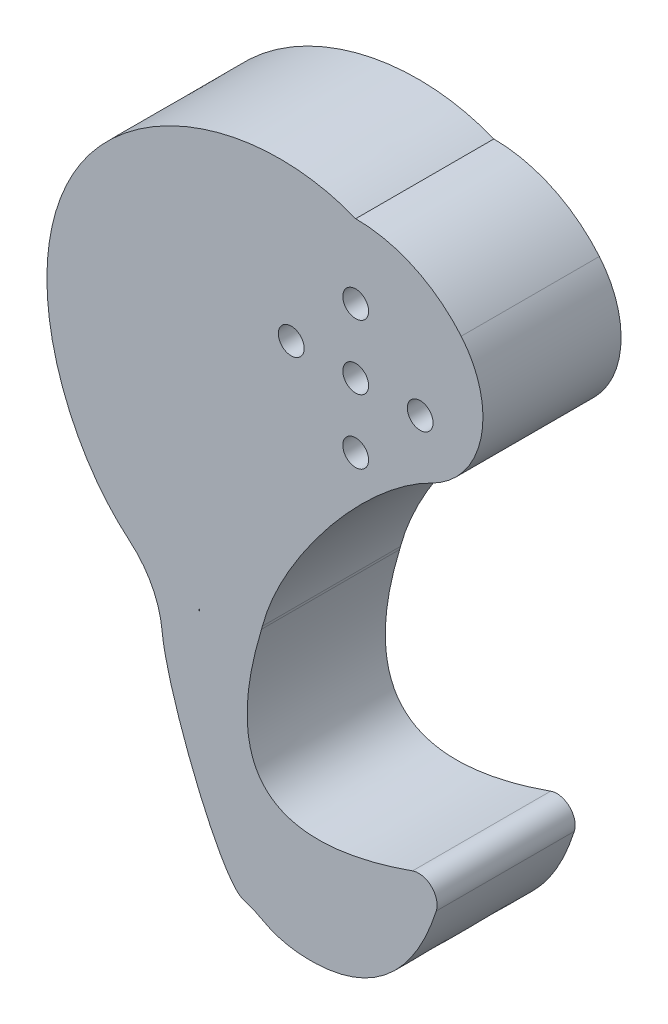
from build123d import *

# Parameters (mm, degrees)
EXTRUDE_1_DEPTH     = 15
SKETCH_3_R          = 1.4
CUT_EXTRUDE_2_DEPTH = 45.491091955
CUT_EXTRUDE_3_DEPTH = 45.491091955
EXTRUDE_2_DEPTH     = 15
FILLET_1_R          = 2
FILLET_START        = -1
FILLET_2_DEPTH      = 17
FILLET_3_R          = 10
CUT_EXTRUDE_4_DEPTH = 20
CUT_EXTRUDE_5_DEPTH = 20
EXTRUDE_3_DEPTH     = 15
FILLET_10_DEPTH     = 17
FILLET_10_2_DEPTH   = 15
FILLET_11_R         = 5
FILLET_12_R         = 10
EXTRUDE_4_DEPTH     = 15
FILLET_13_R         = 10


with BuildPart() as part:
    # 草图1 → 凸台-拉伸1 (new body)
    with BuildSketch(Plane.XY):
        with BuildLine():
            ThreePointArc((14.095389312, -5.13030215), (12.287280664, 8.603646545), (0, 15))
            add(Edge.make_bspline(
                [(0, 15), (-0.174596768, 14.999999319), (-0.436611581, 14.999693042), (-0.786186323, 14.998643785), (-1.048915847, 14.997519085), (-1.312216235, 14.99603471), (-1.576228693, 14.994161918), (-1.84109342, 14.991865662), (-2.106949414, 14.989104591), (-2.373934268, 14.985831089), (-2.642183971, 14.981991319), (-2.911832716, 14.977525266), (-3.1830127, 14.972366794), (-3.455853932, 14.966443701), (-3.730484039, 14.959677782), (-4.007028071, 14.9519849), (-4.285608318, 14.943275054), (-4.566344116, 14.933452466), (-4.849351664, 14.922415656), (-5.134743838, 14.910057537), (-5.422630012, 14.896265505), (-5.713115875, 14.880921543), (-6.006303259, 14.863902316), (-6.302289959, 14.84507929), (-6.601169567, 14.824318836), (-6.903031299, 14.801482354), (-7.207959833, 14.776426392), (-7.516035146, 14.749002775), (-7.827332351, 14.719058736), (-8.141921549, 14.686437053), (-8.459867669, 14.650976187), (-8.781230323, 14.612510428), (-9.106063662, 14.570870045), (-9.434416233, 14.525881438), (-9.766330843, 14.477367292), (-10.101844426, 14.425146744), (-10.440987913, 14.36903554), (-10.783786108, 14.30884621), (-11.130257567, 14.244388236), (-11.480414483, 14.175468229), (-11.834262574, 14.101890107), (-12.191800976, 14.023455277), (-12.553022141, 13.939962822), (-12.917911738, 13.851209688), (-13.286448564, 13.756990875), (-13.658604451, 13.657099633), (-14.03434419, 13.551327657), (-14.413625446, 13.439465288), (-14.796398691, 13.321301714), (-15.182607133, 13.196625177), (-15.572186657, 13.065223175), (-15.965065767, 12.926882676), (-16.361165533, 12.781390325), (-16.760399548, 12.62853266), (-17.162673883, 12.468096321), (-17.567887059, 12.299868276), (-17.975930009, 12.12363602), (-18.386686074, 11.939187837), (-18.800030904, 11.746312879), (-19.21583277, 11.544801919), (-19.63395132, 11.334445536), (-20.054242271, 11.115042096), (-20.476539575, 10.886368472), (-20.900723293, 10.648292485), (-21.326461435, 10.400346233), (-21.753514654, 10.143757392), (-22.178049863, 9.87535726), (-22.595959424, 9.592299141), (-23.006858872, 9.296248411), (-23.410215858, 8.987163154), (-23.805723663, 8.665361009), (-24.19302422, 8.331073979), (-24.571782966, 7.984568061), (-24.94166894, 7.626110759), (-25.302360391, 7.255979562), (-25.65354351, 6.874459377), (-25.994913004, 6.481842935), (-26.326172169, 6.078430394), (-26.647033089, 5.664529144), (-26.957216795, 5.240453567), (-27.256453426, 4.80652479), (-27.544482381, 4.363070443), (-27.82105247, 3.910424411), (-28.085922052, 3.448926584), (-28.338859169, 2.978922599), (-28.579641679, 2.500763586), (-28.808057373, 2.014805906), (-29.023904095, 1.521410888), (-29.226989847, 1.020944566), (-29.417132895, 0.513777409), (-29.594161862, 0.000284053), (-29.757915818, -0.519156969), (-29.908244365, -1.044163505), (-30.045007708, -1.574350056), (-30.168076728, -2.109328051), (-30.277333041, -2.648706129), (-30.372669056, -3.192090415), (-30.453988019, -3.739084801), (-30.521204062, -4.289291227), (-30.574242228, -4.842309963), (-30.613038507, -5.39773989), (-30.637539851, -5.955178784), (-30.647704191, -6.514223598), (-30.643500444, -7.074470745), (-30.624908509, -7.63551638), (-30.591919266, -8.196956684), (-30.544534557, -8.758388145), (-30.48276717, -9.319407838), (-30.406640805, -9.879613709), (-30.316190047, -10.438604851), (-30.21146032, -10.995981785), (-30.092507839, -11.551346736), (-29.95939956, -12.104303912), (-29.812213112, -12.654459772), (-29.651036733, -13.201423307), (-29.475969194, -13.744806302), (-29.287119719, -14.284223615), (-29.084607895, -14.819293432), (-28.868563581, -15.349637541), (-28.639126801, -15.874881588), (-28.396447646, -16.394655341), (-28.140686152, -16.908592941), (-27.872012186, -17.416333158), (-27.590605319, -17.917519643), (-27.296654692, -18.411801174), (-26.990358881, -18.898831896), (-26.671925755, -19.378271573), (-26.341572303, -19.849785794), (-25.885480421, -20.467504768), (-25.526267712, -20.917866263), (-25.279466623, -21.21199112)],
                knots=[0, 0, 0, 0, 0.008983592, 0.013481544, 0.017986876, 0.022502032, 0.027029448, 0.031571543, 0.036130722, 0.040709366, 0.045309838, 0.049934477, 0.054585593, 0.059265472, 0.063976367, 0.068720504, 0.073500073, 0.078317234, 0.083174111, 0.088072793, 0.093015336, 0.098003759, 0.103040044, 0.108126138, 0.113263955, 0.118455369, 0.123702222, 0.129006319, 0.134369433, 0.139793302, 0.145279632, 0.150830096, 0.156446337, 0.162129965, 0.167882565, 0.173705688, 0.179600863, 0.185569587, 0.191613334, 0.197733555, 0.203931674, 0.210209093, 0.216567194, 0.223007337, 0.229530862, 0.236139089, 0.242833322, 0.249614847, 0.256484933, 0.263444834, 0.270495789, 0.277639024, 0.284875752, 0.292207171, 0.299634469, 0.307158825, 0.314781404, 0.322503362, 0.330325849, 0.338250002, 0.346276954, 0.354407827, 0.362643738, 0.370985797, 0.379435108, 0.387992769, 0.396619209, 0.405274739, 0.413959558, 0.422673829, 0.431417677, 0.440191194, 0.448994436, 0.457827427, 0.466690157, 0.475582587, 0.484504647, 0.493456237, 0.50243723, 0.511447469, 0.520486775, 0.529554938, 0.538651727, 0.547776885, 0.556930133, 0.566111169, 0.575319669, 0.584555288, 0.593817663, 0.603106409, 0.612421123, 0.621761385, 0.631126755, 0.64051678, 0.649930987, 0.659368891, 0.66882999, 0.678313767, 0.687819694, 0.697347228, 0.706895812, 0.71646488, 0.726053851, 0.735662137, 0.745289135, 0.754934234, 0.764596814, 0.774276244, 0.783971886, 0.793683092, 0.803409207, 0.813149569, 0.822903507, 0.832670344, 0.8424494, 0.852239983, 0.862041401, 0.871852953, 0.881673937, 0.891503642, 0.901341356, 0.911186363, 0.921037943, 0.930895373, 0.940757928, 0.95062488, 0.960495499, 0.970369054, 0.980244811, 1, 1, 1, 1], degree=3))
            add(Edge.make_bspline(
                [(-25.279466623, -21.21199112), (-25.03266702, -21.506118015), (-24.650058643, -21.936850324), (-24.116326131, -22.48889957), (-23.704647777, -22.89139552), (-23.281933222, -23.282038607), (-22.848561661, -23.660506241), (-22.404923763, -24.026490317), (-21.951421131, -24.379697722), (-21.48846567, -24.719850743), (-21.016478952, -25.046687464), (-20.535891561, -25.359962134), (-20.047142425, -25.659445508), (-19.550678137, -25.944925156), (-19.04695226, -26.216205747), (-18.536424623, -26.4731093), (-18.019560603, -26.715475403), (-17.496830406, -26.943161412), (-16.968708336, -27.156042604), (-16.435672059, -27.354012309), (-15.898201862, -27.536982008), (-15.35677991, -27.704881402), (-14.811889501, -27.857658441), (-14.264014323, -27.995279333), (-13.713637708, -28.117728512), (-13.161241887, -28.225008578), (-12.607307258, -28.317140209), (-12.052311649, -28.394162034), (-11.496729594, -28.456130483), (-10.941031611, -28.5031196), (-10.385683496, -28.535220833), (-9.831145623, -28.552542784), (-9.277872252, -28.555210939), (-8.726310862, -28.543367367), (-8.176901485, -28.517170386), (-7.630076062, -28.476794208), (-7.086257816, -28.422428554), (-6.545860639, -28.354278239), (-6.009288499, -28.272562744), (-5.476934872, -28.177515748), (-4.949182183, -28.069384646), (-4.426401286, -27.948430045), (-3.908950946, -27.814925234), (-3.397177365, -27.669155633), (-2.891413716, -27.511418228), (-2.391979716, -27.342020982), (-1.899181211, -27.161282232), (-1.413309805, -26.969530066), (-0.934642496, -26.767101692), (-0.463441361, -26.554342786), (4.6748e-05, -26.331606829), (0.455590466, -26.099254437), (0.902974156, -25.857652676), (1.341998114, -25.607174371), (1.77247875, -25.348197408), (2.194248731, -25.081104026), (2.607157097, -24.806280109), (3.011069352, -24.524114474), (3.405867507, -24.234998154), (3.791450116, -23.939323681), (4.167732256, -23.637484373), (4.534645494, -23.329873622), (4.892137816, -23.016884179), (5.240173528, -22.698907455), (5.578733117, -22.376332816), (5.907813101, -22.049546899), (6.22742583, -21.71893292), (6.537599266, -21.384870008), (6.838376738, -21.047732541), (7.129816662, -20.707889495), (7.411992235, -20.365703811), (7.684991105, -20.021531772), (7.948915008, -19.675722401), (8.20387939, -19.32861687), (8.450012994, -18.980547932), (8.687457427, -18.631839373), (8.916366703, -18.282805481), (9.136906768, -17.933750534), (9.349254998, -17.58496832), (9.553599678, -17.236741672), (9.750139466, -16.889342026), (9.939082834, -16.543029011), (10.120647493, -16.198050057), (10.295059808, -15.854640037), (10.462554187, -15.513020927), (10.623372469, -15.173401503), (10.777763289, -14.835977057), (10.925981441, -14.50092915), (11.068287227, -14.168425389), (11.204945795, -13.838619231), (11.336226478, -13.511649827), (11.462402118, -13.187641886), (11.583748391, -12.866705573), (11.70054313, -12.548936438), (11.813065642, -12.234415378), (11.921596028, -11.923208621), (12.026414502, -11.615367753), (12.127800711, -11.310929767), (12.226033064, -11.009917143), (12.321388061, -10.712337965), (12.414139626, -10.418186058), (12.504558455, -10.127441167), (12.592911364, -9.840069152), (12.679460654, -9.556022225), (12.76446348, -9.275239204), (12.848171238, -8.997645806), (12.93082896, -8.723154954), (13.01267473, -8.451667126), (13.093939106, -8.183070715), (13.174844564, -7.917242422), (13.255604965, -7.654047671), (13.336425025, -7.393341046), (13.417499824, -7.134966749), (13.49901432, -6.87875908), (13.581142893, -6.624542932), (13.664048917, -6.372134315), (13.747884322, -6.121340875), (13.832789331, -5.871962488), (13.947500586, -5.541332702), (14.035654827, -5.294414261), (14.095389312, -5.13030215)],
                knots=[0, 0, 0, 0, 0.021270399, 0.031903677, 0.042534645, 0.053162531, 0.063786554, 0.074405932, 0.085019874, 0.095627584, 0.106228257, 0.116821079, 0.127405228, 0.137979868, 0.148544155, 0.15909723, 0.169638222, 0.180166248, 0.190680407, 0.201179787, 0.211663457, 0.222130473, 0.232579872, 0.243010676, 0.253421887, 0.263812492, 0.27418146, 0.284527741, 0.294850266, 0.30514795, 0.315419689, 0.32566436, 0.335880824, 0.346067921, 0.356224476, 0.366349296, 0.376441173, 0.386498878, 0.396521172, 0.406506796, 0.416454478, 0.426362934, 0.436230863, 0.446056956, 0.45583989, 0.465578331, 0.475270938, 0.48491636, 0.49451324, 0.504060215, 0.513555916, 0.522998973, 0.532388013, 0.541721663, 0.550998551, 0.560217309, 0.569376572, 0.578474983, 0.587511192, 0.596483859, 0.605391658, 0.614233274, 0.623007411, 0.631712789, 0.640348151, 0.64891226, 0.657403907, 0.66582191, 0.674165115, 0.682432404, 0.690622694, 0.69873494, 0.706768137, 0.714721328, 0.7225936, 0.730384093, 0.738092, 0.745716573, 0.753257123, 0.760713027, 0.76808373, 0.775368751, 0.782567685, 0.789680206, 0.796706075, 0.803645143, 0.810497353, 0.81726275, 0.823941479, 0.830533798, 0.837040075, 0.8434608, 0.849796585, 0.856048172, 0.86221644, 0.868302406, 0.874307234, 0.880232236, 0.886078882, 0.891848803, 0.897543794, 0.903165817, 0.908717009, 0.914199683, 0.919616328, 0.924969613, 0.930262387, 0.935497677, 0.94067869, 0.945808804, 0.950891568, 0.955930696, 0.960930056, 0.965893662, 0.970825666, 0.975730339, 0.980612064, 0.985475315, 0.990324642, 1, 1, 1, 1], degree=3))
        make_face()
    extrude(amount=EXTRUDE_1_DEPTH)

    # 草图3 → 切除-拉伸2 (cut, through all)
    with BuildSketch(Plane.XY.offset(15)):
        Circle(SKETCH_3_R)
        with Locations((7, 0)):
            Circle(SKETCH_3_R)
        with Locations((0, -7)):
            Circle(SKETCH_3_R)
        with Locations((-7, 0)):
            Circle(SKETCH_3_R)
        with Locations((0, 7)):
            Circle(SKETCH_3_R)
    extrude(amount=-CUT_EXTRUDE_2_DEPTH, mode=Mode.SUBTRACT)

    # 草图4 → 切除-拉伸3 (cut, through all)
    with BuildSketch(Plane(origin=(0, 0, 0), x_dir=(-1, 0, 0), z_dir=(0, 0, -1))):
        with BuildLine():
            add(Edge.make_bspline(
                [(-14.095389312, -5.13030215), (-8.477553271, -2.33145367), (8.442499566, -18.762509722), (12.755936915, -38.178736967), (-14.541457389, -65.503061248), (-22.968832669, -9.551118862), (-14.095389312, -5.13030215)],
                knots=[0, 0, 0, 0, 0.26968314, 0.394975947, 0.574032057, 1, 1, 1, 1], degree=3))
        make_face()
    extrude(amount=-CUT_EXTRUDE_3_DEPTH, mode=Mode.SUBTRACT)

    # 草图5 → 凸台-拉伸2 (add)
    with BuildSketch(Plane(origin=(0, 0, 0), x_dir=(-1, 0, 0), z_dir=(0, 0, -1))):
        with BuildLine():
            add(Edge.make_bspline(
                [(10.171874722, -28.541189548), (17.683846291, -53.151232988), (-9.707997946, -41.889793219)],
                knots=[0, 0, 0, 1, 1, 1], degree=2))
            add(Edge.make_bspline(
                [(-9.707997946, -41.889793219), (-2.463001099, -79.763097153), (48.013392254, -36.744634011), (17.334003198, -27.007773326)],
                knots=[0, 0, 0, 0, 1, 1, 1, 1], degree=3))
            add(Edge.make_bspline(
                [(17.334003198, -27.007773326), (16.861768371, -27.20105705), (16.027625054, -27.506859328), (14.814842143, -27.864848675), (13.716286363, -28.124971876), (12.609659956, -28.324417343), (11.498796153, -28.463423353), (10.685046818, -28.521336018), (10.242958884, -28.538751516), (10.171874722, -28.541189548)],
                knots=[0.183395931, 0.183395931, 0.183395931, 0.183395931, 0.211663457, 0.232579872, 0.253421887, 0.27418146, 0.294850266, 0.315419689, 0.319359962, 0.319359962, 0.319359962, 0.319359962], degree=3))
        make_face()
    extrude(amount=-EXTRUDE_2_DEPTH)

    # 圆角1
    fillet_1_edges = [part.edges().sort_by_distance(p)[0] for p in [
        (9.707997946, -41.889793219, 7.5),
    ]]
    fillet(fillet_1_edges, radius=FILLET_1_R)

    # 圆角2: read off the stored shape, not the designer's step
    # 圆角2 outline → 圆角2 (cut)
    with BuildSketch(Plane.XY.offset(FILLET_START)):
        with BuildLine():
            add(Edge.make_bspline(
                [(-10.171874722, -28.541189548), (-10.158393322, -28.488116713), (-10.144653776, -28.435026787), (-10.130657706, -28.381918891)],
                knots=[0.681495055, 0.681495055, 0.681495055, 0.681495055, 0.683012829, 0.683012829, 0.683012829, 0.683012829], degree=3))
            ThreePointArc((-10.130657706, -28.381918891), (-10.17712039, -28.552114075), (-10.226578366, -28.721463095))
            add(Edge.make_bspline(
                [(-10.171874722, -28.541189548), (-10.199461913, -28.631568216), (-10.226578366, -28.721463095)],
                knots=[0, 0, 0, 0.00367243, 0.00367243, 0.00367243], degree=2))
        make_face()
    extrude(amount=FILLET_2_DEPTH, mode=Mode.SUBTRACT)

    # 圆角3
    fillet_3_edges = [part.edges().sort_by_distance(p)[0] for p in [
        (14.095389312, -5.13030215, 7.5),
    ]]
    fillet(fillet_3_edges, radius=FILLET_3_R)

    # 草图6 → 切除-拉伸4 (cut)
    with BuildSketch(Plane(origin=(0, 0, 0), x_dir=(-1, 0, 0), z_dir=(0, 0, -1))):
        with BuildLine():
            ThreePointArc((17.334004909, -28.838535505), (17.371905963, -27.923154694), (17.334004909, -27.007773884))
            add(Edge.make_bspline(
                [(13.73055902, -54.95243101), (25.941820402, -48.919462484), (34.820440249, -32.557525348), (17.334004909, -27.007773884)],
                knots=[0.430026556, 0.430026556, 0.430026556, 0.430026556, 0.999999963, 0.999999963, 0.999999963, 0.999999963], degree=3))
            add(Edge.make_bspline(
                [(17.334004909, -28.838535505), (28.052279378, -41.223912757), (13.73055902, -54.95243101)],
                knots=[0, 0, 0, 1, 1, 1], degree=2))
        make_face()
    extrude(amount=-CUT_EXTRUDE_4_DEPTH, mode=Mode.SUBTRACT)

    # 草图7 → 切除-拉伸5 (cut)
    with BuildSketch(Plane(origin=(0, 0, 0), x_dir=(-1, 0, 0), z_dir=(0, 0, -1))):
        with BuildLine():
            add(Edge.make_bspline(
                [(17.334004909, -28.838535505), (16.357819767, -30.417478072), (18.89407609, -39.049467108), (16.627660878, -45.968198336), (10.616921472, -60.726222639), (45.520515414, -46.002345599), (19.509062719, -25.320461714), (17.334004909, -28.838535505)],
                knots=[0, 0, 0, 0, 0.142925417, 0.277103606, 0.387123085, 0.681544994, 1, 1, 1, 1], degree=3))
        make_face()
    extrude(amount=-CUT_EXTRUDE_5_DEPTH, mode=Mode.SUBTRACT)

    # 草图8 → 凸台-拉伸3 (add)
    with BuildSketch(Plane(origin=(0, 0, 0), x_dir=(-1, 0, 0), z_dir=(0, 0, -1))):
        with BuildLine():
            Line((16.976273943, -30.581588683), (17.024745895, -29.81773752))
            add(Edge.make_bspline(
                [(17.334004909, -28.838535505), (17.175593703, -29.094759642), (17.077337103, -29.426647448), (17.024745895, -29.81773752)],
                knots=[0, 0, 0, 0, 0.023193334, 0.023193334, 0.023193334, 0.023193334], degree=3))
            ThreePointArc((17.334004909, -28.838535505), (17.371905963, -27.923154692), (17.334004909, -27.00777388))
            add(Edge.make_bspline(
                [(25.279466623, -21.21199112), (25.03266702, -21.506118015), (24.522565573, -22.08037929), (23.710347977, -22.89714981), (22.853982967, -23.66650411), (21.956551734, -24.385919792), (21.021309056, -25.053113105), (20.051664575, -25.666053342), (19.051161351, -26.222973885), (18.141767865, -26.664887828), (17.563839778, -26.913704036), (17.334004909, -27.00777388)],
                knots=[0, 0, 0, 0, 0.021270399, 0.042534645, 0.063786554, 0.085019874, 0.106228257, 0.127405228, 0.148544155, 0.169638222, 0.183395905, 0.183395905, 0.183395905, 0.183395905], degree=3))
            add(Edge.make_bspline(
                [(0, 15), (0.262014797, 14.999998978), (0.699343525, 14.999238628), (1.401538909, 14.995786143), (2.109980659, 14.989734033), (2.915961101, 14.978337798), (3.830049802, 14.958681331), (4.763807339, 14.928169831), (5.720653756, 14.882540631), (6.609655012, 14.826186274), (7.419163121, 14.759812824), (8.145673453, 14.687272778), (8.785203026, 14.613390937), (9.438606806, 14.526799364), (10.106250398, 14.426094011), (10.788405492, 14.309813904), (11.485245709, 14.176446723), (12.196842822, 14.024434295), (12.923163255, 13.852178372), (13.66406489, 13.658046601), (14.419294178, 13.440378683), (15.322614234, 13.155138445), (16.377663761, 12.783459779), (17.443972468, 12.357968513), (18.393385732, 11.939741847), (19.080016401, 11.613131439), (19.63395132, 11.334445536), (20.054242271, 11.115042096), (20.476539575, 10.886368472), (20.900723293, 10.648292485), (21.326461435, 10.400346233), (21.753514654, 10.143757392), (22.178049863, 9.87535726), (22.595959424, 9.592299141), (23.006858872, 9.296248411), (23.410215858, 8.987163154), (23.938454649, 8.557365376), (24.578113739, 7.988760142), (25.308901303, 7.259788657), (26.00163562, 6.485268624), (26.653910974, 5.667573262), (27.263461632, 4.809190379), (27.828167604, 3.912715665), (28.346059328, 2.980844637), (28.815322092, 2.016364607), (29.234300033, 1.022146413), (29.60149972, 0.001136003), (29.915593327, -1.043654147), (30.175421367, -2.109153728), (30.37999501, -3.192243409), (30.528497954, -4.289763734), (30.620287863, -5.398524083), (30.654897363, -6.515311681), (30.6320346, -7.636900631), (30.551583347, -8.76006095), (30.413602677, -9.881567589), (30.218326197, -10.998209417), (29.966160838, -12.106798143), (29.657685215, -13.20417716), (29.293647561, -14.287230295), (28.874963232, -15.35289043), (28.402711797, -16.398147996), (27.878133718, -17.420059297), (27.302626627, -18.415754665), (26.677741219, -19.382446423), (26.005176442, -20.317436362), (25.526267712, -20.917866263), (25.279466623, -21.21199112)],
                knots=[0, 0, 0, 0, 0.013481544, 0.022502032, 0.036130722, 0.049934477, 0.063976367, 0.083174111, 0.098003759, 0.113263955, 0.129006319, 0.139793302, 0.150830096, 0.162129965, 0.173705688, 0.185569587, 0.197733555, 0.210209093, 0.223007337, 0.236139089, 0.249614847, 0.263444834, 0.284875752, 0.307158825, 0.322503362, 0.338250002, 0.346276954, 0.354407827, 0.362643738, 0.370985797, 0.379435108, 0.387992769, 0.396619209, 0.405274739, 0.413959558, 0.422673829, 0.431417677, 0.448994436, 0.466690157, 0.484504647, 0.50243723, 0.520486775, 0.538651727, 0.556930133, 0.575319669, 0.593817663, 0.612421123, 0.631126755, 0.649930987, 0.66882999, 0.687819694, 0.706895812, 0.726053851, 0.745289135, 0.764596814, 0.783971886, 0.803409207, 0.822903507, 0.8424494, 0.862041401, 0.881673937, 0.901341356, 0.921037943, 0.940757928, 0.960495499, 0.980244811, 1, 1, 1, 1], degree=3))
            add(Edge.make_bspline(
                [(0, 15), (9.955491464, 18.994366054), (30.470804679, 12.348663999), (35.897228225, -12.360904323), (27.290369493, -26.992176206), (20.618940745, -30.087622849)],
                knots=[0, 0, 0, 0, 0.427134128, 0.682739763, 0.947421443, 0.947421443, 0.947421443, 0.947421443], degree=3))
            add(Edge.make_bspline(
                [(20.618940745, -30.087622849), (22.084451222, -35.206607817), (15.938636074, -51.775642121), (16.976273943, -30.581588683)],
                knots=[0, 0, 0, 0, 1, 1, 1, 1], degree=3))
        make_face()
    extrude(amount=-EXTRUDE_3_DEPTH)

    # 圆角10: read off the stored shape, not the designer's step
    # 圆角10 outline → 圆角10 (cut)
    with BuildSketch(Plane.XY.offset(FILLET_START)):
        with BuildLine():
            add(Edge.make_bspline(
                [(-14.453784771, -54.244039702), (-14.100526804, -54.5977872), (-13.73055902, -54.95243101)],
                knots=[0.974167364, 0.974167364, 0.974167364, 1, 1, 1], degree=2))
            ThreePointArc((-13.73055902, -54.95243101), (-14.127196959, -53.770289977), (-14.373636144, -52.547977868))
            add(Edge.make_bspline(
                [(-14.373636144, -52.547977868), (-14.283642901, -53.202857107), (-14.293684823, -53.783741225), (-14.453784771, -54.244039702)],
                knots=[0.355170291, 0.355170291, 0.355170291, 0.355170291, 0.387123085, 0.387123085, 0.387123085, 0.387123085], degree=3))
        make_face()
    extrude(amount=FILLET_10_DEPTH, mode=Mode.SUBTRACT)

    # Fillet 10 2 outline → Fillet 10 2 (add)
    with BuildSketch(Plane.XY):
        with BuildLine():
            ThreePointArc((-18.74589655, -40.537425822), (-17.877770434, -42.02328087), (-17.277247378, -43.635974343))
            add(Edge.make_bspline(
                [(-17.798712345, -41.01989795), (-17.696310486, -41.915313353), (-17.516700944, -42.771824813), (-17.277247378, -43.635974343)],
                knots=[0.182137805, 0.182137805, 0.182137805, 0.182137805, 0.223707572, 0.223707572, 0.223707572, 0.223707572], degree=3))
            add(Edge.make_bspline(
                [(-17.798712345, -41.01989795), (-18.085894593, -41.209228549), (-18.413933309, -41.007454549), (-18.74589655, -40.537425822)],
                knots=[0.335471124, 0.335471124, 0.335471124, 0.335471124, 0.47112469, 0.47112469, 0.47112469, 0.47112469], degree=3))
        make_face()
    extrude(amount=FILLET_10_2_DEPTH)

    # 圆角11
    fillet_11_edges = [part.edges().sort_by_distance(p)[0] for p in [
        (-20.618940745, -30.087622849, 7.5),
    ]]
    fillet(fillet_11_edges, radius=FILLET_11_R)

    # 圆角12
    fillet_12_edges = [part.edges().sort_by_distance(p)[0] for p in [
        (-13.73055902, -54.95243101, 7.5),
    ]]
    fillet(fillet_12_edges, radius=FILLET_12_R)

    # 草图9 → 凸台-拉伸4 (add)
    with BuildSketch(Plane(origin=(0, 0, 0), x_dir=(-1, 0, 0), z_dir=(0, 0, -1))):
        with BuildLine():
            add(Edge.make_bspline(
                [(20.833410383, -32.649873448), (21.508384286, -33.538007339), (19.021507662, -44.08533859), (10.815064374, -60.889845226), (10.868488682, -42.868316155), (19.719134403, -31.183703784), (20.833410383, -32.649873448)],
                knots=[0, 0, 0, 0, 0.194450208, 0.494404678, 0.678993225, 1, 1, 1, 1], degree=3))
        make_face()
    extrude(amount=-EXTRUDE_4_DEPTH)

    # 圆角13
    fillet_13_edges = [part.edges().sort_by_distance(p)[0] for p in [
        (-20.833410383, -32.649873448, 7.5),
        (-11.677276884, -54.995385558, 7.5),
    ]]
    fillet(fillet_13_edges, radius=FILLET_13_R)


solid = part.part
